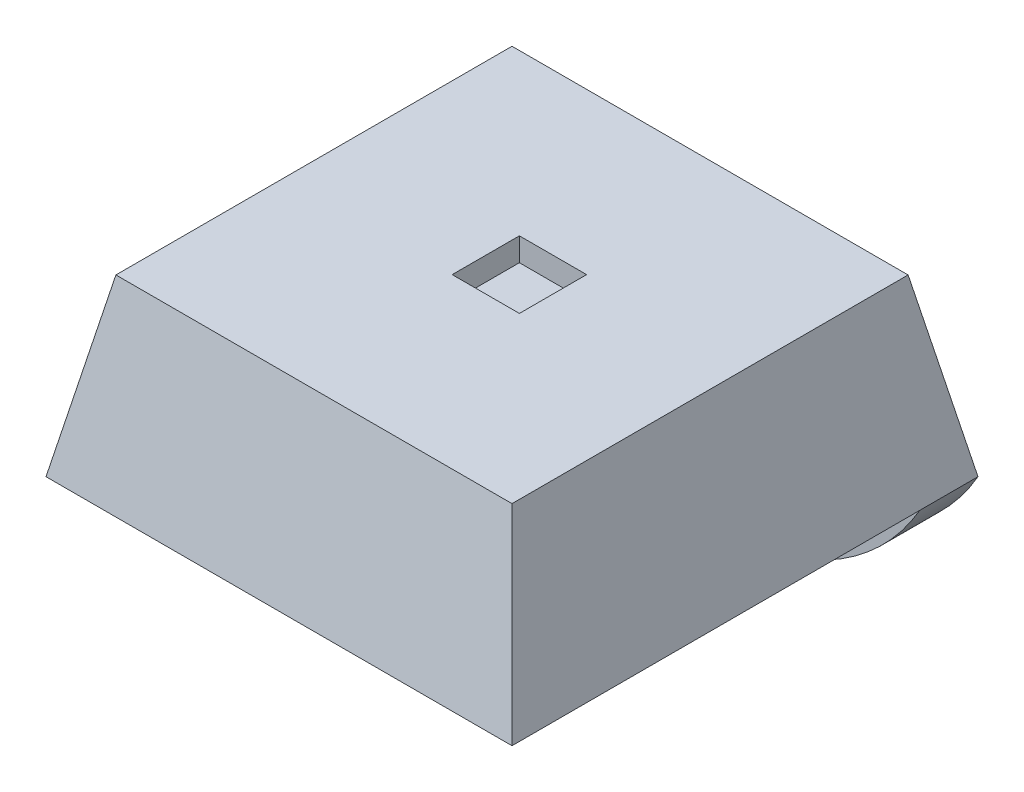
from build123d import *

# Parameters (mm, degrees)
SKETCH1_W               = 8
SKETCH1_H               = 8
BOSS_EXTRUDE1_DEPTH     = 3
CUT_EXTRUDE1_DEPTH      = 12.704699911
CUT_EXTRUDE1_DEPTH_BACK = 12.704699911
CUT_EXTRUDE2_DEPTH      = 11
SKETCH4_R               = 1.75
CUT_EXTRUDE3_DEPTH      = 0.4
SKETCH5_W               = 8
SKETCH5_H               = 1
BOSS_EXTRUDE2_DEPTH     = 2
FILLET1_R               = 4
SKETCH6_W               = 1.153846154
SKETCH6_H               = 1.153846154
CUT_EXTRUDE4_DEPTH      = 0.4


with BuildPart() as part:
    # Sketch1 → Boss-Extrude1 (new body)
    with BuildSketch(Plane(origin=(0, 0, 0), x_dir=(1, 0, 0), z_dir=(0, 1, 0))):
        with Locations((4, 4)):
            Rectangle(SKETCH1_W, SKETCH1_H)
    extrude(amount=BOSS_EXTRUDE1_DEPTH)

    # Sketch2 → Cut-Extrude1 (cut, two sides: drawn at the far end of the back side and taken through both)
    with BuildSketch(Plane.XY.offset(-CUT_EXTRUDE1_DEPTH_BACK)):
        Polygon((0, 0), (0.6, 3), (0, 3), align=None)
        Polygon((8, 0), (7.4, 3), (8, 3), align=None)
    extrude(amount=CUT_EXTRUDE1_DEPTH + CUT_EXTRUDE1_DEPTH_BACK, mode=Mode.SUBTRACT)

    # Sketch3 → Cut-Extrude2 (cut)
    with BuildSketch(Plane(origin=(0, 0, 0), x_dir=(0, 0, -1), z_dir=(1, 0, 0))):
        Polygon((0, 0), (0.6, 3), (0, 3), align=None)
        Polygon((8, 3), (7.4, 3), (8, 0), align=None)
    extrude(amount=CUT_EXTRUDE2_DEPTH, mode=Mode.SUBTRACT)

    # Sketch4 → Cut-Extrude3 (cut)
    with BuildSketch(Plane.XZ):
        with Locations(Location((4, -3.75, 0), (0, 0, 270))):
            Circle(SKETCH4_R)
    extrude(amount=-CUT_EXTRUDE3_DEPTH, mode=Mode.SUBTRACT)

    # Sketch5 → Boss-Extrude2 (add)
    with BuildSketch(Plane.XZ):
        with Locations((4, -7.5)):
            Rectangle(SKETCH5_W, SKETCH5_H)
    extrude(amount=BOSS_EXTRUDE2_DEPTH)

    # Fillet1
    # the kernel refuses this fillet: 4 mm, written as the material it takes off along each edge
    with BuildSketch(Plane(origin=(8, -2, -16.660254038), x_dir=(0, 1, 0), z_dir=(0, 0, 1)), Plane(origin=(0, -2, 1.660254038), x_dir=(0, 1, 0), z_dir=(0, 0, -1))) as fillet1_piece_1:
        with BuildLine():
            CenterArc((4, 3.464101615), FILLET1_R, 180, 60)
            Line((0, 3.464101615), (-0.08, 3.464101615))
            Line((-0.08, 3.464101615), (-0.08, 0))
            Line((-0.08, 0), (0, -0.08))
            ThreePointArc((0, -0.08), (1, -0.08), (1.96, -0.069282032))
            Line((1.96, -0.069282032), (2, 0))
        make_face()
    extrude(amount=18.320508076, mode=Mode.SUBTRACT)

    # Sketch6 → Cut-Extrude4 (cut)
    with BuildSketch(Plane(origin=(0, 3, 0), x_dir=(1, 0, 0), z_dir=(0, 1, 0))):
        with Locations((4.058809338, 4.067977948)):
            Rectangle(SKETCH6_W, SKETCH6_H)
    extrude(amount=-CUT_EXTRUDE4_DEPTH, mode=Mode.SUBTRACT)


solid = part.part
